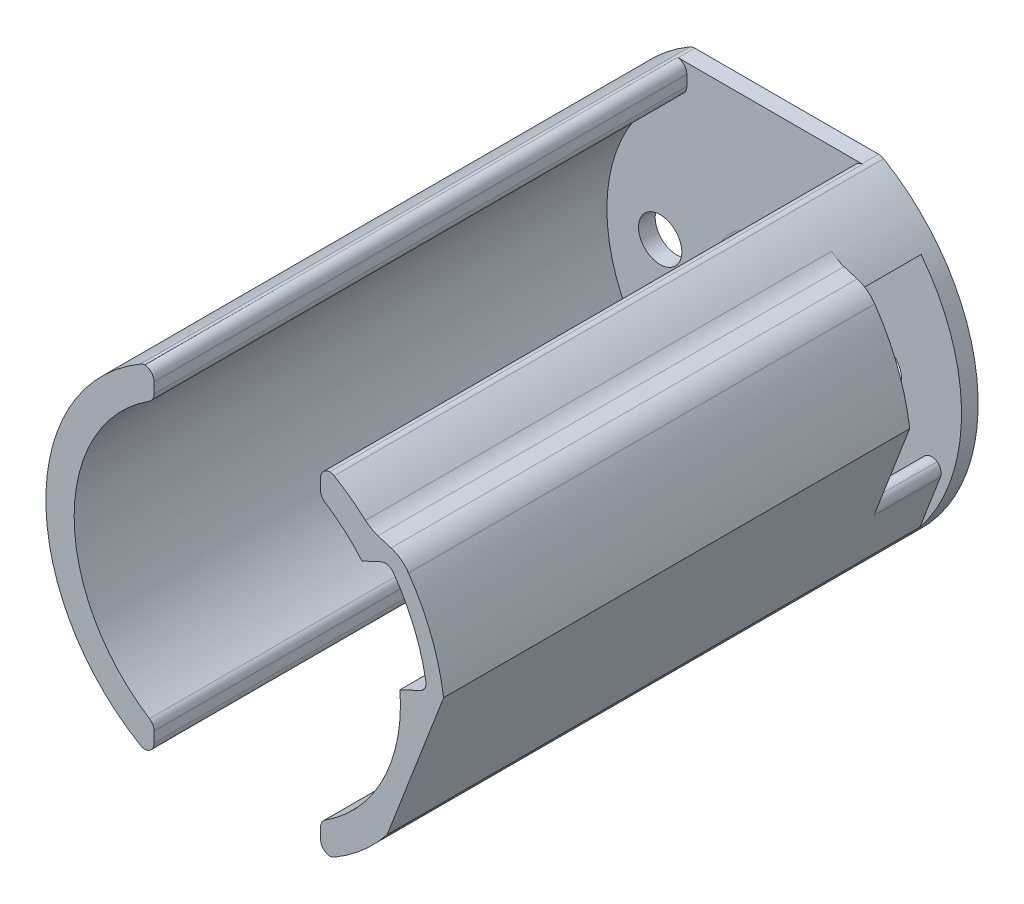
from build123d import *

# Parameters (mm, degrees)
SKETCH1_R           = 14.605
SKETCH1_R_2         = 12.446
BOSS_EXTRUDE1_DEPTH = 40.64
BOSS_EXTRUDE2_START = 1.27
SKETCH2_R           = 14.605
SKETCH2_R_2         = 3.556
SKETCH2_R_3         = 1.651
BOSS_EXTRUDE2_DEPTH = 1.27
SKETCH3_W           = 34.056453184
SKETCH3_H           = 6.418177278
SKETCH3_W_2         = 34.979066167
SKETCH3_H_2         = 5.575791511
CUT_EXTRUDE1_DEPTH  = 47.723229233
SKETCH4_W           = 12.7
SKETCH4_H           = 40.64
CUT_EXTRUDE2_DEPTH  = 51.100654936
CUT_EXTRUDE3_DEPTH  = 40.64
BOSS_EXTRUDE3_DEPTH = 41.91
SKETCH7_R           = 15.875
SKETCH7_R_2         = 14.605
CUT_EXTRUDE4_DEPTH  = 6.35
CUT_EXTRUDE5_DEPTH  = 5.08
CUT_EXTRUDE6_REACH  = 48.533
BOSS_EXTRUDE5_DEPTH = 35.56
FILLET1_R           = 0.762
FILLET2_R           = 2.54


with BuildPart() as part:
    # Sketch1 → Boss-Extrude1 (new body)
    with BuildSketch(Plane.XY):
        Circle(SKETCH1_R)
        Circle(SKETCH1_R_2, mode=Mode.SUBTRACT)
    extrude(amount=BOSS_EXTRUDE1_DEPTH)

    # Sketch2 → Boss-Extrude2 (add)
    with BuildSketch(Plane(origin=(0, 0, 0), x_dir=(-1, 0, 0), z_dir=(0, 0, -1)).offset(BOSS_EXTRUDE2_START)):
        Circle(SKETCH2_R)
        Circle(SKETCH2_R_2, mode=Mode.SUBTRACT)
        with Locations((-8.382, 0)):
            Circle(SKETCH2_R_3, mode=Mode.SUBTRACT)
        with Locations((8.382, 0)):
            Circle(SKETCH2_R_3, mode=Mode.SUBTRACT)
    extrude(amount=-BOSS_EXTRUDE2_DEPTH)

    # Sketch3 → Cut-Extrude1 (cut, through all)
    with BuildSketch(Plane(origin=(0, 0, -1.27), x_dir=(-1, 0, 0), z_dir=(0, 0, -1))):
        with Locations((0.581647316, 15.909088639)):
            Rectangle(SKETCH3_W, SKETCH3_H)
        with Locations((1.042953807, -15.487895756)):
            Rectangle(SKETCH3_W_2, SKETCH3_H_2)
    extrude(amount=-CUT_EXTRUDE1_DEPTH, mode=Mode.SUBTRACT)

    # Sketch4 → Cut-Extrude2 (cut, through all)
    with BuildSketch(Plane(origin=(0, 12.7, 0), x_dir=(1, 0, 0), z_dir=(0, 1, 0))):
        with Locations((0, -20.32)):
            Rectangle(SKETCH4_W, SKETCH4_H)
    extrude(amount=-CUT_EXTRUDE2_DEPTH, mode=Mode.SUBTRACT)

    # Sketch5 → Cut-Extrude3 (cut)
    with BuildSketch(Plane.XY.offset(40.64)):
        Polygon((8.706975565, 7.656948551), (15.156085268, 10.664217794), (18.376436422, 3.758152456), (11.927326719, 0.750883214), align=None)
    extrude(amount=-CUT_EXTRUDE3_DEPTH, mode=Mode.SUBTRACT)

    # Sketch6 → Boss-Extrude3 (add)
    with BuildSketch(Plane(origin=(0, 0, -1.27), x_dir=(-1, 0, 0), z_dir=(0, 0, -1))):
        with BuildLine():
            Line((-12.527218586, 9.751124012), (-10.16966665, 10.48255242))
            ThreePointArc((-10.16966665, 10.48255242), (-10.873649709, 9.75037266), (-11.525041099, 8.971034091))
            ThreePointArc((-11.525041099, 8.971034091), (-13.467409843, 5.651096984), (-14.475687068, 1.93920316))
            ThreePointArc((-14.475687068, 1.93920316), (-14.575462242, 0.928399389), (-14.604741501, -0.086894693))
            Line((-14.604741501, -0.086894693), (-15.734442466, 2.107829522))
            ThreePointArc((-15.734442466, 2.107829522), (-14.638488959, 6.142496722), (-12.527218586, 9.751124012))
        make_face()
    extrude(amount=-BOSS_EXTRUDE3_DEPTH)

    # Sketch7 → Cut-Extrude4 (cut)
    with BuildSketch(Plane(origin=(0, 0, -1.27), x_dir=(-1, 0, 0), z_dir=(0, 0, -1))):
        Circle(SKETCH7_R)
        Circle(SKETCH7_R_2, mode=Mode.SUBTRACT)
    extrude(amount=-CUT_EXTRUDE4_DEPTH, mode=Mode.SUBTRACT)

    # Sketch8 → Cut-Extrude5 (cut)
    with BuildSketch(Plane.XY):
        with BuildLine():
            Line((14.475687068, 1.93920316), (12.407758156, 0.974912072))
            ThreePointArc((12.407758156, 0.974912072), (12.445878018, -0.05510311), (12.398639212, -1.084740374))
            Line((12.398639212, -1.084740374), (14.549423566, -1.272909623))
            ThreePointArc((14.549423566, -1.272909623), (14.601153344, 0.335180604), (14.475687068, 1.93920316))
        make_face()
        with BuildLine():
            Line((14.549423566, -1.272909623), (12.398639212, -1.084740374))
            ThreePointArc((12.398639212, -1.084740374), (12.226851946, -2.325297292), (11.931259886, -3.542309069))
            Line((11.931259886, -3.542309069), (13.780666558, -4.837277563))
            ThreePointArc((13.780666558, -4.837277563), (14.276718156, -3.079179062), (14.549423566, -1.272909623))
        make_face()
    extrude(amount=CUT_EXTRUDE5_DEPTH, mode=Mode.SUBTRACT)

    # Cut-Extrude6: up to this face of the body (flat: up to its plane)
    cut_extrude6_end = Plane(part.part.faces().sort_by_distance((9.524357094, -7.422304107, 0))[0])
    # Sketch11 → Cut-Extrude6 (cut, up to the picked face)
    with BuildSketch(Plane.XY.offset(40.64), mode=Mode.PRIVATE) as cut_extrude6_sk1:
        Polygon((15.734442466, 2.107829522), (11.428920073, -9.093173867), (14.392518886, -10.232343334), (18.698041279, 0.968660056), align=None)
    cut_extrude6_tool1 = split(extrude(cut_extrude6_sk1.sketch, amount=-CUT_EXTRUDE6_REACH, mode=Mode.PRIVATE), bisect_by=cut_extrude6_end, keep=Keep.BOTH, mode=Mode.PRIVATE)
    add(cut_extrude6_tool1.solids().sort_by(Axis((15.063481, -4.062257, 40.64), (0, 0, -1)))[0], mode=Mode.SUBTRACT)

    # Sketch12 → Boss-Extrude5 (add)
    with BuildSketch(Plane.XY.offset(40.64)):
        Polygon((14.577046288, -0.903186872), (15.734442466, 2.107829522), (15.155744377, 2.330273663), (13.998348199, -0.680742731), align=None)
    extrude(amount=-BOSS_EXTRUDE5_DEPTH)

    # Fillet1
    # the kernel refuses this fillet: 0.762 mm, written as the material it adds along each edge
    with BuildSketch(Plane(origin=(14.475687068, 1.93920316, 40.64), x_dir=(-0.1526781379658876, 0.9882759666142191, 0), z_dir=(0, 0, -1))) as fillet1_piece_1:
        with BuildLine():
            CenterArc((0.57198511, -0.76184596), FILLET1_R, 88.847914045, 74.934246566)
            Line((-0.159692452, -0.549026914), (0, 0))
            ThreePointArc((0, 0), (0.29365307, 0.002952442), (0.587306139, 0))
        make_face()
    extrude(amount=35.56)
    with BuildSketch(Plane(origin=(11.525041099, 8.971034091, 40.64), x_dir=(0.5968718617370223, -0.8023365756754336, 0), z_dir=(0, 0, -1))) as fillet1_piece_2:
        with BuildLine():
            CenterArc((0.62099819, 0.761818426), FILLET1_R, 191.646188227, 79.60463439)
            Line((-0.12531439, 0.60799537), (0, 0))
            ThreePointArc((0, 0), (0.318816035, -0.00348017), (0.63763207, 0))
        make_face()
    extrude(amount=35.56)
    # the kernel refuses this fillet: 0.762 mm, written as the material it takes off along each edge
    with BuildSketch(Plane(origin=(0, 0, 0), x_dir=(-1, 0, 0), z_dir=(0, -1, 0))) as fillet1_2_piece_1:
        with BuildLine():
            CenterArc((3.556 + FILLET1_R, FILLET1_R), FILLET1_R, 180, 90)
            Line((3.556, FILLET1_R), (3.556, 0))
            Line((3.556, 0), (3.556 + FILLET1_R, 0))
        make_face()
    revolve(axis=Axis((0, 0, 0), (0, 0, -1)), mode=Mode.SUBTRACT)
    with BuildSketch(Plane(origin=(11.931259886, -3.542309069, 0), x_dir=(-0.32230782021248533, -0.9466349185561855, 0), z_dir=(0, 0, 1))) as fillet1_2_piece_2:
        with BuildLine():
            CenterArc((1.014668485, 0.761403744), FILLET1_R, 163.802549626, 103.930693134)
            Line((0.282915237, 0.973962404), (0, 0))
            ThreePointArc((0, 0), (0.492264909, 0.009738855), (0.984529818, 0))
        make_face()
    extrude(amount=5.08, mode=Mode.SUBTRACT)
    with BuildSketch(Plane(origin=(13.216640292, -4.442342119, 0), x_dir=(-0.35879353276176223, -0.9334169490899199, 0), z_dir=(0, 0, 1))) as fillet1_2_piece_3:
        with BuildLine():
            CenterArc((FILLET1_R * 0.781652785228, -FILLET1_R), FILLET1_R, 90, 76.026121217)
            Line((-FILLET1_R * 0.1887531327, -FILLET1_R * 0.758520488551), (0, 0))
            Line((0, 0), (FILLET1_R * 0.781652785228, 0))
        make_face()
    extrude(amount=5.08, mode=Mode.SUBTRACT)
    with BuildSketch(Plane(origin=(-7.212213599, 12.7, -1.794261411), x_dir=(1, 0, 0), z_dir=(0, 0, 1)), Plane(origin=(-7.212213599, -12.7, 41.164261411), x_dir=(1, 0, 0), z_dir=(0, 0, -1))) as fillet1_2_piece_4:
        with BuildLine():
            CenterArc((0.204160731, -0.762), FILLET1_R, 90, 30.414529102)
            ThreePointArc((-0.181603647, -0.104862385), (-0.090990033, -0.052105246), (0, 0))
            Line((0, 0), (0.204160731, 0))
        make_face()
    extrude(amount=42.958522823, mode=Mode.SUBTRACT)
    with BuildSketch(Plane(origin=(7.212213599, 12.7, -1.794261411), x_dir=(0.8659975867148599, -0.500048177482969, -1.8558242316030044e-14), z_dir=(0, 0, 1)), Plane(origin=(7.212213599, -12.7, 41.164261411), x_dir=(0.8659975867148587, 0.5000481774829708, -1.8313973834794986e-14), z_dir=(0, 0, -1))) as fillet1_2_piece_5:
        with BuildLine():
            CenterArc((0.204234011, -0.761980363), FILLET1_R, 89.588658346, 30.414529102)
            Line((-0.176802701, -0.102090202), (0, 0))
            ThreePointArc((0, 0), (0.104852282, 0.000376383), (0.209704565, 0))
        make_face()
    extrude(amount=42.958522823, mode=Mode.SUBTRACT)
    with BuildSketch(Plane(origin=(-6.35, 10.704224213, 41.703745389), x_dir=(0, 1, 0), z_dir=(0, 0, -1))) as fillet1_2_piece_6:
        with BuildLine():
            CenterArc((0.425498156, -0.762), FILLET1_R, 90, 57.421029607)
            ThreePointArc((-0.216601212, -0.351692308), (-0.106841566, -0.176744751), (0, 0))
            Line((0, 0), (0.425498156, 0))
        make_face()
    extrude(amount=41.703745389, mode=Mode.SUBTRACT)
    with BuildSketch(Plane(origin=(-6.35, -10.704224213, 41.703745389), x_dir=(0, -1, 0), z_dir=(0, 0, -1)), Plane(origin=(6.35, 10.704224213, 41.703745389), x_dir=(0, 1, 0), z_dir=(0, 0, -1))) as fillet1_2_piece_7:
        with BuildLine():
            CenterArc((0.425498156, 0.762), FILLET1_R, 212.578970393, 57.421029607)
            ThreePointArc((-0.216601212, 0.351692308), (-0.106841566, 0.176744751), (0, 0))
            Line((0, 0), (0.425498156, 0))
        make_face()
    extrude(amount=41.703745389, mode=Mode.SUBTRACT)
    with BuildSketch(Plane(origin=(6.35, -10.704224213, 41.703745389), x_dir=(0.8514689576122441, 0.5244050097231324, 0), z_dir=(0, 0, -1))) as fillet1_2_piece_8:
        with BuildLine():
            CenterArc((0.425685981, 0.761895088), FILLET1_R, 211.628197432, 57.421029608)
            Line((-0.223133364, 0.362298471), (0, 0))
            ThreePointArc((0, 0), (0.206520922, 0.001713556), (0.413041843, 0))
        make_face()
    extrude(amount=41.703745389, mode=Mode.SUBTRACT)
    with BuildSketch(Plane(origin=(6.35, -12.7, 42.545), x_dir=(1, 0, 0), z_dir=(0, 0, -1)), Plane(origin=(-6.35, -12.7, 0), x_dir=(-1, 0, 0), z_dir=(0, 0, 1))) as fillet1_2_piece_9:
        with BuildLine():
            CenterArc((FILLET1_R, -FILLET1_R), FILLET1_R, 90, 90)
            Line((0, -FILLET1_R), (0, 0))
            Line((0, 0), (FILLET1_R, 0))
        make_face()
    extrude(amount=42.545, mode=Mode.SUBTRACT)
    with BuildSketch(Plane(origin=(-6.35, 12.7, 0), x_dir=(-1, 0, 0), z_dir=(0, 0, 1)), Plane(origin=(6.35, 12.7, 42.545), x_dir=(1, 0, 0), z_dir=(0, 0, -1))) as fillet1_2_piece_10:
        with BuildLine():
            CenterArc((FILLET1_R, FILLET1_R), FILLET1_R, 180, 90)
            Line((0, FILLET1_R), (0, 0))
            Line((0, 0), (FILLET1_R, 0))
        make_face()
    extrude(amount=42.545, mode=Mode.SUBTRACT)

    # Fillet2
    fillet2_edges = [part.edges().sort_by_distance(p)[0] for p in [
        (12.527218586, 9.751124012, 22.86),
        (10.16966665, 10.48255242, 22.86),
    ]]
    fillet(fillet2_edges, radius=FILLET2_R)


solid = part.part
